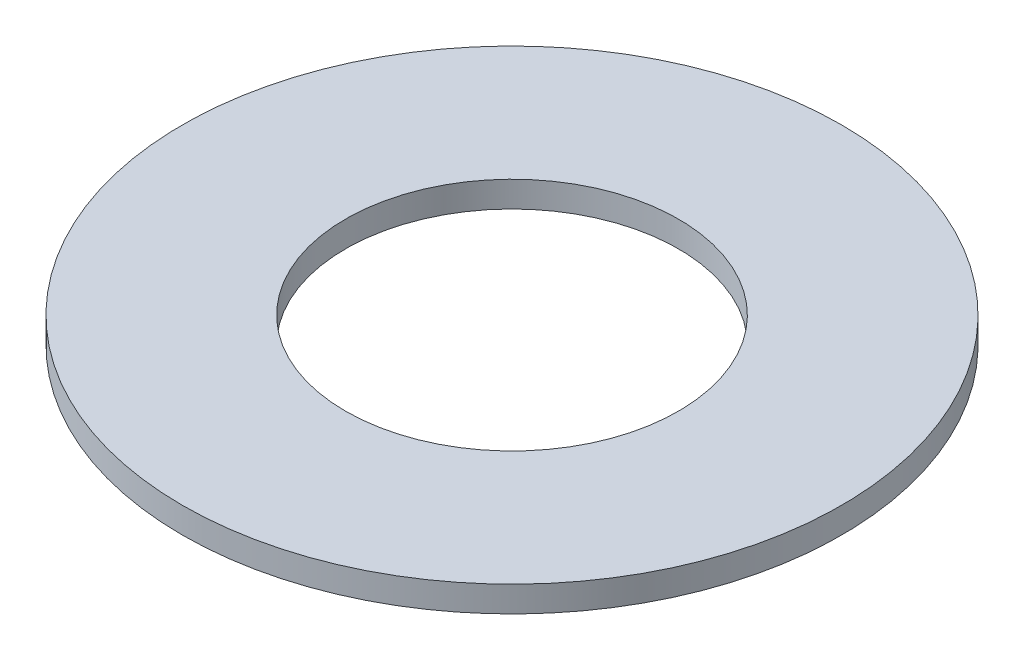
from build123d import *

# Parameters (mm, degrees)
SKETCH1_R           = 10.0584
SKETCH1_R_2         = 5.08
BOSS_EXTRUDE1_DEPTH = 0.7874


with BuildPart() as part:
    # Sketch1 → Boss-Extrude1 (new body)
    with BuildSketch(Plane(origin=(0, 0, 0), x_dir=(1, 0, 0), z_dir=(0, 1, 0))):
        Circle(SKETCH1_R)
        Circle(SKETCH1_R_2, mode=Mode.SUBTRACT)
    extrude(amount=BOSS_EXTRUDE1_DEPTH)


solid = part.part
